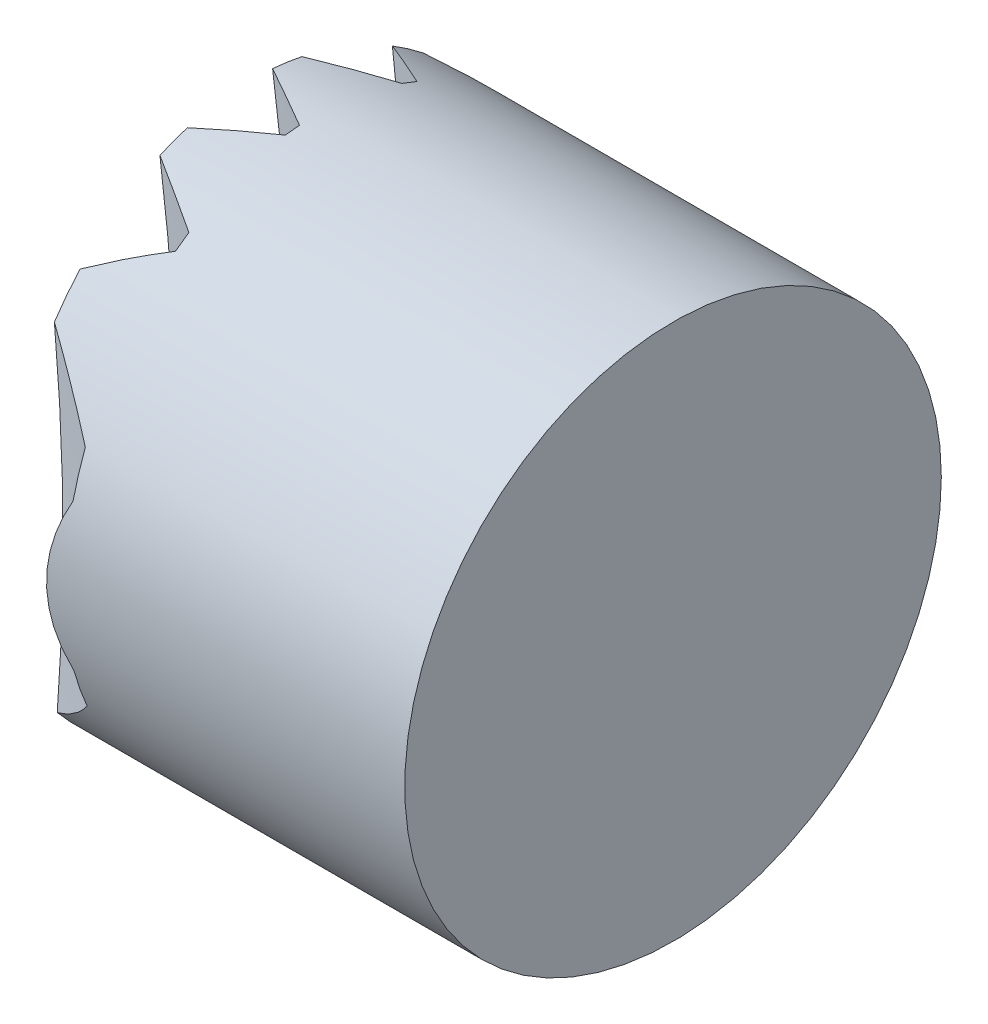
from build123d import *

# Parameters (mm, degrees)
CROQUIS1_R                 = 31.5
CROQUIS1_R_2               = 26.25
SALIENTE_EXTRUIR1_DEPTH    = 30
ROSCA1_PITCH               = 1.5
CORTAR_EXTRUIR1_DEPTH      = 77.558868965
CORTAR_EXTRUIR1_DEPTH_BACK = 77.558868965
CROQUIS4_R                 = 50.692956163
CROQUIS4_R_2               = 3.5
CROQUIS9_R                 = 28.056233803
CORTAR_EXTRUIR5_DEPTH      = 37.698092739
SALIENTE_EXTRUIR3_REACH    = 21.61
CROQUIS10_R                = 3.5


with BuildPart() as part:
    # Croquis1 → Saliente-Extruir1 (new body)
    with BuildSketch(Plane.XY):
        Circle(CROQUIS1_R)
        Circle(CROQUIS1_R_2, mode=Mode.SUBTRACT)
    extrude(amount=SALIENTE_EXTRUIR1_DEPTH)

    # Rosca1: the profile of Perfil de rosca1 profile screwed along a right-hand helix of 46.666667 turns, 8 arcs to a turn; built about Z, then put on its axis
    rosca1_z = Axis((0, 0, 0), (0, 0, 1))
    rosca1_corners = [(26.2497, 1e-08, -0.000173205), (27.061898812, 1e-08, 0.468749998), (27.061898812, 1e-08, 0.656249998), (26.2497, 1e-08, 1.125173201)]
    with BuildLine(mode=Mode.PRIVATE) as rosca1_profile:
        Line(rosca1_corners[0], rosca1_corners[1])
        Line(rosca1_corners[1], rosca1_corners[2])
        Line(rosca1_corners[2], rosca1_corners[3])
        Line(rosca1_corners[3], rosca1_corners[0])
    rosca1_cap = Face(rosca1_profile.wire())
    rosca1_turn_angles = [0, 22.5, 45, 67.5, 90, 112.5, 135, 157.5, 180, 202.5, 225, 247.5, 270, 292.5, 315, 337.5, 360, 382.5, 405, 427.5, 450, 472.5, 495, 517.5, 540, 562.5, 585, 607.5, 630, 652.5, 675, 697.5, 720]
    rosca1_turn_weights = [1, 0.9238795325112867, 1, 0.9238795325112867, 1, 0.9238795325112867, 1, 0.9238795325112867, 1, 0.9238795325112867, 1, 0.9238795325112867, 1, 0.9238795325112867, 1, 0.9238795325112867, 1, 0.9238795325112867, 1, 0.9238795325112867, 1, 0.9238795325112867, 1, 0.9238795325112867, 1, 0.9238795325112867, 1, 0.9238795325112867, 1, 0.9238795325112867, 1, 0.9238795325112867, 1]
    rosca1_turn_rails = [Edge.make_bspline([Vector(p[0], p[1], 0).rotate(rosca1_z, rosca1_turn_angles[k]) / rosca1_turn_weights[k] + Vector(0, 0, p[2] + ROSCA1_PITCH * rosca1_turn_angles[k] / 360) for k in range(33)], [0, 0, 0, 1, 1, 2, 2, 3, 3, 4, 4, 5, 5, 6, 6, 7, 7, 8, 8, 9, 9, 10, 10, 11, 11, 12, 12, 13, 13, 14, 14, 15, 15, 16, 16, 16], 2, rosca1_turn_weights) for p in rosca1_corners]
    rosca1_turn_sides = [Face.make_surface_from_curves(rosca1_turn_rails[p[0]], rosca1_turn_rails[p[1]]) for p in [(0, 1), (1, 2), (2, 3), (3, 0)]]
    rosca1_last_angles = [16560, 16582.5, 16605, 16627.5, 16650, 16672.5, 16695, 16717.5, 16740, 16762.5, 16785, 16792.5, 16800]
    rosca1_last_weights = [1, 0.9238795325112867, 1, 0.9238795325112867, 1, 0.9238795325112867, 1, 0.9238795325112867, 1, 0.9238795325112867, 1, 0.9914448613738146, 1]
    rosca1_last_rails = [Edge.make_bspline([Vector(p[0], p[1], 0).rotate(rosca1_z, rosca1_last_angles[k]) / rosca1_last_weights[k] + Vector(0, 0, p[2] + ROSCA1_PITCH * rosca1_last_angles[k] / 360) for k in range(13)], [0, 0, 0, 1, 1, 2, 2, 3, 3, 4, 4, 5, 5, 6, 6, 6], 2, rosca1_last_weights) for p in rosca1_corners]
    rosca1_last_sides = [Face.make_surface_from_curves(rosca1_last_rails[p[0]], rosca1_last_rails[p[1]]) for p in [(0, 1), (1, 2), (2, 3), (3, 0)]]
    rosca1 = Plane(origin=(0, 0, 30), x_dir=(-0.939692621, 0.342020143, 0), z_dir=(0, 0, -1)) * Solid(Shell([*[p.moved(Location((0, 0, 2 * ROSCA1_PITCH * i))) for i in range(23) for p in rosca1_turn_sides], *rosca1_last_sides, rosca1_cap, rosca1_cap.rotate(rosca1_z, 16800).moved(Location((0, 0, ROSCA1_PITCH * 16800 / 360)))]))
    add(rosca1, mode=Mode.SUBTRACT)

    # Croquis4 → Cortar-Extruir1 (cut, two sides: drawn at the far end of the back side and taken through both)
    with BuildSketch(Plane(origin=(31.5, 0, 0), x_dir=(0, 0, -1), z_dir=(1, 0, 0)).offset(-CORTAR_EXTRUIR1_DEPTH_BACK)):
        with Locations((-15, 0)):
            Circle(CROQUIS4_R)
        with Locations((-15, 0)):
            Circle(CROQUIS4_R_2, mode=Mode.SUBTRACT)
    extrude(amount=CORTAR_EXTRUIR1_DEPTH + CORTAR_EXTRUIR1_DEPTH_BACK, mode=Mode.SUBTRACT)


with BuildPart() as cortar_extruir1_piece_1:
    # of the separate pieces the step leaves, piece 1, a body of its own (cortar_extruir1_pieces)
    add(part.part.solids().sort_by_distance((-31.5, 0, 11.5))[0])

    # Croquis9 → Cortar-Extruir5 (cut, through all)
    with BuildSketch(Plane(origin=(0, 0, 0), x_dir=(0, 0, -1), z_dir=(1, 0, 0))):
        with Locations((-15.360643384, 0)):
            Circle(CROQUIS9_R)
    extrude(amount=-CORTAR_EXTRUIR5_DEPTH, mode=Mode.SUBTRACT)


with BuildPart() as cortar_extruir1_piece_2:
    # of the separate pieces the step leaves, piece 2, a body of its own (cortar_extruir1_pieces)
    add(part.part.solids().sort_by_distance((31.5, 0, 11.5))[0])

    # Croquis10 → Saliente-Extruir3 (add, up to next)
    with BuildSketch(Plane(origin=(31.5, 0, 0), x_dir=(0, 0, -1), z_dir=(1, 0, 0)), mode=Mode.PRIVATE) as saliente_extruir3_sk1:
        with Locations((-15, 0)):
            Circle(CROQUIS10_R)
    saliente_extruir3_tool1 = extrude(saliente_extruir3_sk1.sketch, amount=-SALIENTE_EXTRUIR3_REACH, mode=Mode.PRIVATE) - cortar_extruir1_piece_2.part
    add(saliente_extruir3_tool1.solids().sort_by_distance((31.5, 0, 15))[0])
    add(saliente_extruir3_tool1.solids().sort_by_distance((31.5, 0, 15))[1])


solid = cortar_extruir1_piece_2.part
